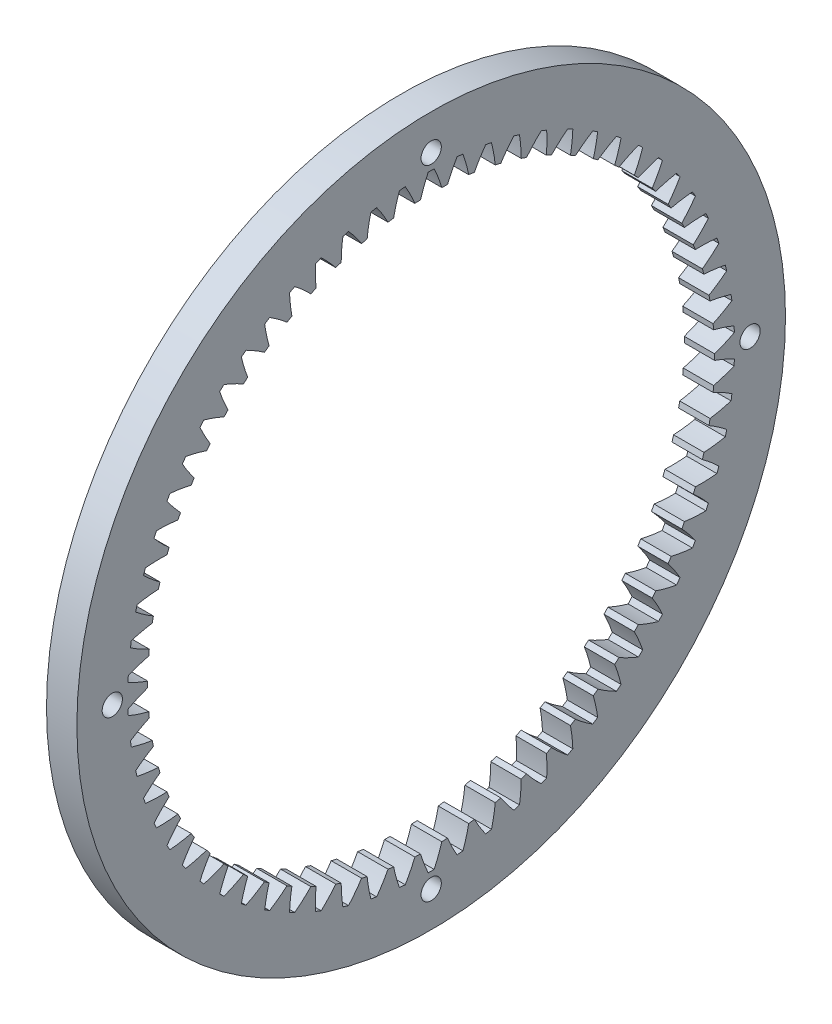
from build123d import *

# Parameters (mm, degrees)
METRIC_INTERNAL_SPUR_GEAR_1_75M_66_2_R       = 70
METRIC_INTERNAL_SPUR_GEAR_1_75M_66T_20_DEPTH = 6
CUT_EXTRUDE1_DEPTH                           = 100.176610146
CUT_EXTRUDE1_DEPTH_BACK                      = 100.176610146
SKETCH1_R                                    = 2


# Read off the part's stored shape, not the designer's step: Metric - Internal spur gear 1.75M 66T 20PA 6FW ---S66S140OD 1AF
with BuildPart() as part:
    # Metric - Internal spur gear 1.75M 66 2 → Metric - Internal spur gear 1.75M 66T 20 (new body)
    with BuildSketch(Plane.YZ):
        Circle(METRIC_INTERNAL_SPUR_GEAR_1_75M_66_2_R)
        with BuildLine():
            ThreePointArc((59.935672078, -0.582232555), (57.976135812, -1.414265202), (55.960623747, -2.099664224))
            ThreePointArc((55.960623747, -2.099664224), (55.936570994, -2.664587286), (55.906815483, -3.229238693))
            ThreePointArc((55.906815483, -3.229238693), (57.848049834, -4.103120777), (59.719623438, -5.117651679))
            ThreePointArc((59.719623438, -5.117651679), (59.667093831, -5.697516651), (59.608933992, -6.276844002))
            ThreePointArc((59.608933992, -6.276844002), (57.579180926, -6.918843376), (55.507643936, -7.409552256))
            ThreePointArc((55.507643936, -7.409552256), (55.430000745, -7.969630943), (55.346706441, -8.528897123))
            ThreePointArc((55.346706441, -8.528897123), (57.196082959, -9.583348259), (58.962744639, -10.771189668))
            ThreePointArc((58.962744639, -10.771189668), (58.855333221, -11.34343571), (58.742368168, -11.914611377))
            ThreePointArc((58.742368168, -11.914611377), (56.660780061, -12.360763433), (54.551978307, -12.652338235))
            ThreePointArc((54.551978307, -12.652338235), (54.421447826, -13.202500388), (54.285369055, -13.751316541))
            ThreePointArc((54.285369055, -13.751316541), (56.026139501, -14.976787454), (57.671890095, -16.327182095))
            ThreePointArc((57.671890095, -16.327182095), (57.510569599, -16.886626858), (57.343822362, -17.444478186))
            ThreePointArc((57.343822362, -17.444478186), (55.229250398, -17.690742502), (53.102281514, -17.78054268))
            ThreePointArc((53.102281514, -17.78054268), (52.920045848, -18.315805946), (52.73241496, -18.849201907))
            ThreePointArc((52.73241496, -18.849201907), (54.348814646, -20.234594544), (55.858749983, -21.735313032))
            ThreePointArc((55.858749983, -21.735313032), (55.644981353, -22.276890098), (55.42596202, -22.8163651))
            ThreePointArc((55.42596202, -22.8163651), (53.29755609, -22.860511468), (51.171682237, -22.747723778))
            ThreePointArc((51.171682237, -22.747723778), (50.93939174, -23.263240728), (50.701907949, -23.776385981))
            ThreePointArc((50.701907949, -23.776385981), (52.17929851, -25.309154011), (53.539744381, -26.946605609))
            ThreePointArc((53.539744381, -26.946605609), (53.275463539, -27.465410372), (53.006155584, -27.981623478))
            ThreePointArc((53.006155584, -27.981623478), (50.883190862, -27.823252101), (48.777664281, -27.508897966))
            ThreePointArc((48.777664281, -27.508897966), (48.497422612, -28), (48.212236609, -28.488247422))
            ThreePointArc((48.212236609, -28.488247422), (49.537238567, -30.154509861), (50.735874563, -31.913865553))
            ThreePointArc((50.735874563, -31.913865553), (50.423474878, -32.405199637), (50.106317194, -32.893475941))
            ThreePointArc((50.106317194, -32.893475941), (48.008019577, -32.534021056), (45.941908244, -32.020947314))
            ThreePointArc((45.941908244, -32.020947314), (45.616253315, -32.483186936), (45.285947788, -32.942114883))
            ThreePointArc((45.285947788, -32.942114883), (46.44656172, -34.7267818), (47.472532809, -36.592108589))
            ThreePointArc((47.472532809, -36.592108589), (47.114843419, -37.051522396), (46.752708237, -37.507439992))
            ThreePointArc((46.752708237, -37.507439992), (44.698080233, -36.950156877), (42.690095172, -36.243010005))
            ThreePointArc((42.690095172, -36.243010005), (42.321976164, -36.672201101), (41.949542411, -37.09765345))
            ThreePointArc((41.949542411, -37.09765345), (42.935257617, -38.984562625), (43.779272446, -40.938967822))
            ThreePointArc((43.779272446, -40.938967822), (43.379532643, -41.36230083), (42.975699514, -41.781730859))
            ThreePointArc((42.975699514, -41.781730859), (40.983348153, -41.031666356), (39.051673987, -40.136850385))
            ThreePointArc((39.051673987, -40.136850385), (38.644424643, -40.529106134), (38.233235482, -40.917229923))
            ThreePointArc((38.233235482, -40.917229923), (39.035125173, -42.889293215), (39.689540213, -44.915077423))
            ThreePointArc((39.689540213, -44.915077423), (39.251370102, -45.298495862), (38.809496201, -45.6776399))
            ThreePointArc((38.809496201, -45.6776399), (36.897464525, -44.741586711), (35.059594795, -43.667205232))
            ThreePointArc((35.059594795, -43.667205232), (34.616903228, -44.018973306), (34.170682452, -44.366253625))
            ThreePointArc((34.170682452, -44.366253625), (34.781484591, -46.405611723), (35.240373357, -48.484429128))
            ThreePointArc((35.240373357, -48.484429128), (34.767741074, -48.824460702), (34.291828081, -49.159885162))
            ThreePointArc((34.291828081, -49.159885162), (32.477431745, -48.046320327), (30.750010484, -46.802103107))
            ThreePointArc((30.750010484, -46.802103107), (30.275885777, -47.110197839), (29.798674431, -47.413489665))
            ThreePointArc((29.798674431, -47.413489665), (30.212857498, -49.501673826), (30.472064223, -51.614698335))
            ThreePointArc((30.472064223, -51.614698335), (29.96925, -51.908263665), (29.463607855, -52.19693089))
            ThreePointArc((29.463607855, -52.19693089), (27.763278314, -50.915939027), (26.161949316, -49.513153888))
            ThreePointArc((26.161949316, -49.513153888), (25.660685217, -49.774785125), (25.156804999, -50.031341799))
            ThreePointArc((25.156804999, -50.031341799), (25.37061809, -52.149441104), (25.427795357, -54.277536841))
            ThreePointArc((25.427795357, -54.277536841), (24.899352757, -54.521977354), (24.368560635, -54.76127313))
            ThreePointArc((24.368560635, -54.76127313), (22.797696335, -53.324455099), (21.336961484, -51.775805881))
            ThreePointArc((21.336961484, -51.775805881), (20.813097517, -51.988604249), (20.287111645, -52.196102355))
            ThreePointArc((20.287111645, -52.196102355), (20.298618435, -54.324934969), (20.153248438, -56.448829568))
            ThreePointArc((20.153248438, -56.448829568), (19.603963119, -56.641931572), (19.052827955, -56.8296888))
            ThreePointArc((19.052827955, -56.8296888), (17.625654888, -55.250056647), (16.318742824, -53.569568158))
            ThreePointArc((16.318742824, -53.569568158), (15.777023183, -53.731606522), (15.233695067, -53.888166926))
            ThreePointArc((15.233695067, -53.888166926), (15.042791348, -56.008453811), (14.696190581, -58.108912954))
            ThreePointArc((14.696190581, -58.108912954), (14.131036956, -58.248927688), (13.564549916, -58.383446009))
            ThreePointArc((13.564549916, -58.383446009), (12.29399278, -56.675305128), (11.152739103, -54.87819613))
            ThreePointArc((11.152739103, -54.87819613), (10.598069685, -54.988007047), (10.042319788, -55.092211911))
            ThreePointArc((10.042319788, -55.092211911), (9.650734413, -57.184751421), (9.106041746, -59.242753025))
            ThreePointArc((9.106041746, -59.242753025), (8.530137934, -59.328412494), (7.953429211, -59.408473689))
            ThreePointArc((7.953429211, -59.408473689), (6.850994371, -57.587293268), (5.885734449, -55.68983866))
            ThreePointArc((5.885734449, -55.68983866), (5.323138425, -55.746427664), (4.759999705, -55.797333295))
            ThreePointArc((4.759999705, -55.797333295), (4.171278933, -57.843175067), (3.433427187, -59.840081551))
            ThreePointArc((3.433427187, -59.840081551), (2.851988661, -59.87061001), (2.27028102, -59.895489032))
            ThreePointArc((2.27028102, -59.895489032), (1.345952295, -57.977761962), (0.565427672, -55.997145387))
            ThreePointArc((0.565427672, -55.997145387), (0, -56), (-0.565427672, -55.997145387))
            ThreePointArc((-0.565427672, -55.997145387), (-1.345952295, -57.977761962), (-2.27028102, -59.895489032))
            ThreePointArc((-2.27028102, -59.895489032), (-2.851988661, -59.87061001), (-3.433427187, -59.840081551))
            ThreePointArc((-3.433427187, -59.840081551), (-4.171278933, -57.843175067), (-4.759999705, -55.797333295))
            ThreePointArc((-4.759999705, -55.797333295), (-5.323138425, -55.746427664), (-5.885734449, -55.68983866))
            ThreePointArc((-5.885734449, -55.68983866), (-6.850994371, -57.587293268), (-7.953429211, -59.408473689))
            ThreePointArc((-7.953429211, -59.408473689), (-8.530137934, -59.328412494), (-9.106041746, -59.242753025))
            ThreePointArc((-9.106041746, -59.242753025), (-9.650734413, -57.184751421), (-10.042319788, -55.092211911))
            ThreePointArc((-10.042319788, -55.092211911), (-10.598069685, -54.988007047), (-11.152739103, -54.87819613))
            ThreePointArc((-11.152739103, -54.87819613), (-12.29399278, -56.675305128), (-13.564549916, -58.383446009))
            ThreePointArc((-13.564549916, -58.383446009), (-14.131036956, -58.248927688), (-14.696190581, -58.108912954))
            ThreePointArc((-14.696190581, -58.108912954), (-15.042791348, -56.008453811), (-15.233695067, -53.888166926))
            ThreePointArc((-15.233695067, -53.888166926), (-15.777023183, -53.731606522), (-16.318742824, -53.569568158))
            ThreePointArc((-16.318742824, -53.569568158), (-17.625654888, -55.250056647), (-19.052827955, -56.8296888))
            ThreePointArc((-19.052827955, -56.8296888), (-19.603963119, -56.641931572), (-20.153248438, -56.448829568))
            ThreePointArc((-20.153248438, -56.448829568), (-20.298618435, -54.324934969), (-20.287111645, -52.196102355))
            ThreePointArc((-20.287111645, -52.196102355), (-20.813097517, -51.988604249), (-21.336961484, -51.775805881))
            ThreePointArc((-21.336961484, -51.775805881), (-22.797696335, -53.324455099), (-24.368560635, -54.76127313))
            ThreePointArc((-24.368560635, -54.76127313), (-24.899352757, -54.521977354), (-25.427795357, -54.277536841))
            ThreePointArc((-25.427795357, -54.277536841), (-25.37061809, -52.149441104), (-25.156804999, -50.031341799))
            ThreePointArc((-25.156804999, -50.031341799), (-25.660685217, -49.774785125), (-26.161949316, -49.513153888))
            ThreePointArc((-26.161949316, -49.513153888), (-27.763278314, -50.915939027), (-29.463607855, -52.19693089))
            ThreePointArc((-29.463607855, -52.19693089), (-29.96925, -51.908263665), (-30.472064223, -51.614698335))
            ThreePointArc((-30.472064223, -51.614698335), (-30.212857498, -49.501673826), (-29.798674431, -47.413489665))
            ThreePointArc((-29.798674431, -47.413489665), (-30.275885777, -47.110197839), (-30.750010484, -46.802103107))
            ThreePointArc((-30.750010484, -46.802103107), (-32.477431745, -48.046320327), (-34.291828081, -49.159885162))
            ThreePointArc((-34.291828081, -49.159885162), (-34.767741074, -48.824460702), (-35.240373357, -48.484429128))
            ThreePointArc((-35.240373357, -48.484429128), (-34.781484591, -46.405611723), (-34.170682452, -44.366253625))
            ThreePointArc((-34.170682452, -44.366253625), (-34.616903228, -44.018973306), (-35.059594795, -43.667205232))
            ThreePointArc((-35.059594795, -43.667205232), (-36.897464525, -44.741586711), (-38.809496201, -45.6776399))
            ThreePointArc((-38.809496201, -45.6776399), (-39.251370102, -45.298495862), (-39.689540213, -44.915077423))
            ThreePointArc((-39.689540213, -44.915077423), (-39.035125173, -42.889293215), (-38.233235482, -40.917229923))
            ThreePointArc((-38.233235482, -40.917229923), (-38.644424643, -40.529106134), (-39.051673987, -40.136850385))
            ThreePointArc((-39.051673987, -40.136850385), (-40.983348153, -41.031666356), (-42.975699514, -41.781730859))
            ThreePointArc((-42.975699514, -41.781730859), (-43.379532643, -41.36230083), (-43.779272446, -40.938967822))
            ThreePointArc((-43.779272446, -40.938967822), (-42.935257617, -38.984562625), (-41.949542411, -37.09765345))
            ThreePointArc((-41.949542411, -37.09765345), (-42.321976164, -36.672201101), (-42.690095172, -36.243010005))
            ThreePointArc((-42.690095172, -36.243010005), (-44.698080233, -36.950156877), (-46.752708237, -37.507439992))
            ThreePointArc((-46.752708237, -37.507439992), (-47.114843419, -37.051522396), (-47.472532809, -36.592108589))
            ThreePointArc((-47.472532809, -36.592108589), (-46.44656172, -34.7267818), (-45.285947788, -32.942114883))
            ThreePointArc((-45.285947788, -32.942114883), (-45.616253315, -32.483186936), (-45.941908244, -32.020947314))
            ThreePointArc((-45.941908244, -32.020947314), (-48.008019577, -32.534021056), (-50.106317194, -32.893475941))
            ThreePointArc((-50.106317194, -32.893475941), (-50.423474878, -32.405199637), (-50.735874563, -31.913865553))
            ThreePointArc((-50.735874563, -31.913865553), (-49.537238567, -30.154509861), (-48.212236609, -28.488247422))
            ThreePointArc((-48.212236609, -28.488247422), (-48.497422612, -28), (-48.777664281, -27.508897966))
            ThreePointArc((-48.777664281, -27.508897966), (-50.883190862, -27.823252101), (-53.006155584, -27.981623478))
            ThreePointArc((-53.006155584, -27.981623478), (-53.275463539, -27.465410372), (-53.539744381, -26.946605609))
            ThreePointArc((-53.539744381, -26.946605609), (-52.17929851, -25.309154011), (-50.701907949, -23.776385981))
            ThreePointArc((-50.701907949, -23.776385981), (-50.93939174, -23.263240728), (-51.171682237, -22.747723778))
            ThreePointArc((-51.171682237, -22.747723778), (-53.29755609, -22.860511468), (-55.42596202, -22.8163651))
            ThreePointArc((-55.42596202, -22.8163651), (-55.644981353, -22.276890098), (-55.858749983, -21.735313032))
            ThreePointArc((-55.858749983, -21.735313032), (-54.348814646, -20.234594544), (-52.73241496, -18.849201907))
            ThreePointArc((-52.73241496, -18.849201907), (-52.920045848, -18.315805946), (-53.102281514, -17.78054268))
            ThreePointArc((-53.102281514, -17.78054268), (-55.229250398, -17.690742502), (-57.343822362, -17.444478186))
            ThreePointArc((-57.343822362, -17.444478186), (-57.510569599, -16.886626858), (-57.671890095, -16.327182095))
            ThreePointArc((-57.671890095, -16.327182095), (-56.026139501, -14.976787454), (-54.285369055, -13.751316541))
            ThreePointArc((-54.285369055, -13.751316541), (-54.421447826, -13.202500388), (-54.551978307, -12.652338235))
            ThreePointArc((-54.551978307, -12.652338235), (-56.660780061, -12.360763433), (-58.742368168, -11.914611377))
            ThreePointArc((-58.742368168, -11.914611377), (-58.855333221, -11.34343571), (-58.962744639, -10.771189668))
            ThreePointArc((-58.962744639, -10.771189668), (-57.196082959, -9.583348259), (-55.346706441, -8.528897123))
            ThreePointArc((-55.346706441, -8.528897123), (-55.430000745, -7.969630943), (-55.507643936, -7.409552256))
            ThreePointArc((-55.507643936, -7.409552256), (-57.579180926, -6.918843376), (-59.608933992, -6.276844002))
            ThreePointArc((-59.608933992, -6.276844002), (-59.667093831, -5.697516651), (-59.719623438, -5.117651679))
            ThreePointArc((-59.719623438, -5.117651679), (-57.848049834, -4.103120777), (-55.906815483, -3.229238693))
            ThreePointArc((-55.906815483, -3.229238693), (-55.936570994, -2.664587286), (-55.960623747, -2.099664224))
            ThreePointArc((-55.960623747, -2.099664224), (-57.976135812, -1.414265202), (-59.935672078, -0.582232555))
            ThreePointArc((-59.935672078, -0.582232555), (-59.9385, 0), (-59.935672078, 0.582232555))
            ThreePointArc((-59.935672078, 0.582232555), (-57.976135812, 1.414265202), (-55.960623747, 2.099664224))
            ThreePointArc((-55.960623747, 2.099664224), (-55.936570994, 2.664587286), (-55.906815483, 3.229238693))
            ThreePointArc((-55.906815483, 3.229238693), (-57.848049834, 4.103120777), (-59.719623438, 5.117651679))
            ThreePointArc((-59.719623438, 5.117651679), (-59.667093831, 5.697516651), (-59.608933992, 6.276844002))
            ThreePointArc((-59.608933992, 6.276844002), (-57.579180926, 6.918843376), (-55.507643936, 7.409552256))
            ThreePointArc((-55.507643936, 7.409552256), (-55.430000745, 7.969630943), (-55.346706441, 8.528897123))
            ThreePointArc((-55.346706441, 8.528897123), (-57.196082959, 9.583348259), (-58.962744639, 10.771189668))
            ThreePointArc((-58.962744639, 10.771189668), (-58.855333221, 11.34343571), (-58.742368168, 11.914611377))
            ThreePointArc((-58.742368168, 11.914611377), (-56.660780061, 12.360763433), (-54.551978307, 12.652338235))
            ThreePointArc((-54.551978307, 12.652338235), (-54.421447826, 13.202500388), (-54.285369055, 13.751316541))
            ThreePointArc((-54.285369055, 13.751316541), (-56.026139501, 14.976787454), (-57.671890095, 16.327182095))
            ThreePointArc((-57.671890095, 16.327182095), (-57.510569599, 16.886626858), (-57.343822362, 17.444478186))
            ThreePointArc((-57.343822362, 17.444478186), (-55.229250398, 17.690742502), (-53.102281514, 17.78054268))
            ThreePointArc((-53.102281514, 17.78054268), (-52.920045848, 18.315805946), (-52.73241496, 18.849201907))
            ThreePointArc((-52.73241496, 18.849201907), (-54.348814646, 20.234594544), (-55.858749983, 21.735313032))
            ThreePointArc((-55.858749983, 21.735313032), (-55.644981353, 22.276890098), (-55.42596202, 22.8163651))
            ThreePointArc((-55.42596202, 22.8163651), (-53.29755609, 22.860511468), (-51.171682237, 22.747723778))
            ThreePointArc((-51.171682237, 22.747723778), (-50.93939174, 23.263240728), (-50.701907949, 23.776385981))
            ThreePointArc((-50.701907949, 23.776385981), (-52.17929851, 25.309154011), (-53.539744381, 26.946605609))
            ThreePointArc((-53.539744381, 26.946605609), (-53.275463539, 27.465410372), (-53.006155584, 27.981623478))
            ThreePointArc((-53.006155584, 27.981623478), (-50.883190862, 27.823252101), (-48.777664281, 27.508897966))
            ThreePointArc((-48.777664281, 27.508897966), (-48.497422612, 28), (-48.212236609, 28.488247422))
            ThreePointArc((-48.212236609, 28.488247422), (-49.537238567, 30.154509861), (-50.735874563, 31.913865553))
            ThreePointArc((-50.735874563, 31.913865553), (-50.423474878, 32.405199637), (-50.106317194, 32.893475941))
            ThreePointArc((-50.106317194, 32.893475941), (-48.008019577, 32.534021056), (-45.941908244, 32.020947314))
            ThreePointArc((-45.941908244, 32.020947314), (-45.616253315, 32.483186936), (-45.285947788, 32.942114883))
            ThreePointArc((-45.285947788, 32.942114883), (-46.44656172, 34.7267818), (-47.472532809, 36.592108589))
            ThreePointArc((-47.472532809, 36.592108589), (-47.114843419, 37.051522396), (-46.752708237, 37.507439992))
            ThreePointArc((-46.752708237, 37.507439992), (-44.698080233, 36.950156877), (-42.690095172, 36.243010005))
            ThreePointArc((-42.690095172, 36.243010005), (-42.321976164, 36.672201101), (-41.949542411, 37.09765345))
            ThreePointArc((-41.949542411, 37.09765345), (-42.935257617, 38.984562625), (-43.779272446, 40.938967822))
            ThreePointArc((-43.779272446, 40.938967822), (-43.379532643, 41.36230083), (-42.975699514, 41.781730859))
            ThreePointArc((-42.975699514, 41.781730859), (-40.983348153, 41.031666356), (-39.051673987, 40.136850385))
            ThreePointArc((-39.051673987, 40.136850385), (-38.644424643, 40.529106134), (-38.233235482, 40.917229923))
            ThreePointArc((-38.233235482, 40.917229923), (-39.035125173, 42.889293215), (-39.689540213, 44.915077423))
            ThreePointArc((-39.689540213, 44.915077423), (-39.251370102, 45.298495862), (-38.809496201, 45.6776399))
            ThreePointArc((-38.809496201, 45.6776399), (-36.897464525, 44.741586711), (-35.059594795, 43.667205232))
            ThreePointArc((-35.059594795, 43.667205232), (-34.616903228, 44.018973306), (-34.170682452, 44.366253625))
            ThreePointArc((-34.170682452, 44.366253625), (-34.781484591, 46.405611723), (-35.240373357, 48.484429128))
            ThreePointArc((-35.240373357, 48.484429128), (-34.767741074, 48.824460702), (-34.291828081, 49.159885162))
            ThreePointArc((-34.291828081, 49.159885162), (-32.477431745, 48.046320327), (-30.750010484, 46.802103107))
            ThreePointArc((-30.750010484, 46.802103107), (-30.275885777, 47.110197839), (-29.798674431, 47.413489665))
            ThreePointArc((-29.798674431, 47.413489665), (-30.212857498, 49.501673826), (-30.472064223, 51.614698335))
            ThreePointArc((-30.472064223, 51.614698335), (-29.96925, 51.908263665), (-29.463607855, 52.19693089))
            ThreePointArc((-29.463607855, 52.19693089), (-27.763278314, 50.915939027), (-26.161949316, 49.513153888))
            ThreePointArc((-26.161949316, 49.513153888), (-25.660685217, 49.774785125), (-25.156804999, 50.031341799))
            ThreePointArc((-25.156804999, 50.031341799), (-25.37061809, 52.149441104), (-25.427795357, 54.277536841))
            ThreePointArc((-25.427795357, 54.277536841), (-24.899352757, 54.521977354), (-24.368560635, 54.76127313))
            ThreePointArc((-24.368560635, 54.76127313), (-22.797696335, 53.324455099), (-21.336961484, 51.775805881))
            ThreePointArc((-21.336961484, 51.775805881), (-20.813097517, 51.988604249), (-20.287111645, 52.196102355))
            ThreePointArc((-20.287111645, 52.196102355), (-20.298618435, 54.324934969), (-20.153248438, 56.448829568))
            ThreePointArc((-20.153248438, 56.448829568), (-19.603963119, 56.641931572), (-19.052827955, 56.8296888))
            ThreePointArc((-19.052827955, 56.8296888), (-17.625654888, 55.250056647), (-16.318742824, 53.569568158))
            ThreePointArc((-16.318742824, 53.569568158), (-15.777023183, 53.731606522), (-15.233695067, 53.888166926))
            ThreePointArc((-15.233695067, 53.888166926), (-15.042791348, 56.008453811), (-14.696190581, 58.108912954))
            ThreePointArc((-14.696190581, 58.108912954), (-14.131036956, 58.248927688), (-13.564549916, 58.383446009))
            ThreePointArc((-13.564549916, 58.383446009), (-12.29399278, 56.675305128), (-11.152739103, 54.87819613))
            ThreePointArc((-11.152739103, 54.87819613), (-10.598069685, 54.988007047), (-10.042319788, 55.092211911))
            ThreePointArc((-10.042319788, 55.092211911), (-9.650734413, 57.184751421), (-9.106041746, 59.242753025))
            ThreePointArc((-9.106041746, 59.242753025), (-8.530137934, 59.328412494), (-7.953429211, 59.408473689))
            ThreePointArc((-7.953429211, 59.408473689), (-6.850994371, 57.587293268), (-5.885734449, 55.68983866))
            ThreePointArc((-5.885734449, 55.68983866), (-5.323138425, 55.746427664), (-4.759999705, 55.797333295))
            ThreePointArc((-4.759999705, 55.797333295), (-4.171278933, 57.843175067), (-3.433427187, 59.840081551))
            ThreePointArc((-3.433427187, 59.840081551), (-2.851988661, 59.87061001), (-2.27028102, 59.895489032))
            ThreePointArc((-2.27028102, 59.895489032), (-1.345952295, 57.977761962), (-0.565427672, 55.997145387))
            ThreePointArc((-0.565427672, 55.997145387), (0, 56), (0.565427672, 55.997145387))
            ThreePointArc((0.565427672, 55.997145387), (1.345952295, 57.977761962), (2.27028102, 59.895489032))
            ThreePointArc((2.27028102, 59.895489032), (2.851988661, 59.87061001), (3.433427187, 59.840081551))
            ThreePointArc((3.433427187, 59.840081551), (4.171278933, 57.843175067), (4.759999705, 55.797333295))
            ThreePointArc((4.759999705, 55.797333295), (5.323138425, 55.746427664), (5.885734449, 55.68983866))
            ThreePointArc((5.885734449, 55.68983866), (6.850994371, 57.587293268), (7.953429211, 59.408473689))
            ThreePointArc((7.953429211, 59.408473689), (8.530137934, 59.328412494), (9.106041746, 59.242753025))
            ThreePointArc((9.106041746, 59.242753025), (9.650734413, 57.184751421), (10.042319788, 55.092211911))
            ThreePointArc((10.042319788, 55.092211911), (10.598069685, 54.988007047), (11.152739103, 54.87819613))
            ThreePointArc((11.152739103, 54.87819613), (12.29399278, 56.675305128), (13.564549916, 58.383446009))
            ThreePointArc((13.564549916, 58.383446009), (14.131036956, 58.248927688), (14.696190581, 58.108912954))
            ThreePointArc((14.696190581, 58.108912954), (15.042791348, 56.008453811), (15.233695067, 53.888166926))
            ThreePointArc((15.233695067, 53.888166926), (15.777023183, 53.731606522), (16.318742824, 53.569568158))
            ThreePointArc((16.318742824, 53.569568158), (17.625654888, 55.250056647), (19.052827955, 56.8296888))
            ThreePointArc((19.052827955, 56.8296888), (19.603963119, 56.641931572), (20.153248438, 56.448829568))
            ThreePointArc((20.153248438, 56.448829568), (20.298618435, 54.324934969), (20.287111645, 52.196102355))
            ThreePointArc((20.287111645, 52.196102355), (20.813097517, 51.988604249), (21.336961484, 51.775805881))
            ThreePointArc((21.336961484, 51.775805881), (22.797696335, 53.324455099), (24.368560635, 54.76127313))
            ThreePointArc((24.368560635, 54.76127313), (24.899352757, 54.521977354), (25.427795357, 54.277536841))
            ThreePointArc((25.427795357, 54.277536841), (25.37061809, 52.149441104), (25.156804999, 50.031341799))
            ThreePointArc((25.156804999, 50.031341799), (25.660685217, 49.774785125), (26.161949316, 49.513153888))
            ThreePointArc((26.161949316, 49.513153888), (27.763278314, 50.915939027), (29.463607855, 52.19693089))
            ThreePointArc((29.463607855, 52.19693089), (29.96925, 51.908263665), (30.472064223, 51.614698335))
            ThreePointArc((30.472064223, 51.614698335), (30.212857498, 49.501673826), (29.798674431, 47.413489665))
            ThreePointArc((29.798674431, 47.413489665), (30.275885777, 47.110197839), (30.750010484, 46.802103107))
            ThreePointArc((30.750010484, 46.802103107), (32.477431745, 48.046320327), (34.291828081, 49.159885162))
            ThreePointArc((34.291828081, 49.159885162), (34.767741074, 48.824460702), (35.240373357, 48.484429128))
            ThreePointArc((35.240373357, 48.484429128), (34.781484591, 46.405611723), (34.170682452, 44.366253625))
            ThreePointArc((34.170682452, 44.366253625), (34.616903228, 44.018973306), (35.059594795, 43.667205232))
            ThreePointArc((35.059594795, 43.667205232), (36.897464525, 44.741586711), (38.809496201, 45.6776399))
            ThreePointArc((38.809496201, 45.6776399), (39.251370102, 45.298495862), (39.689540213, 44.915077423))
            ThreePointArc((39.689540213, 44.915077423), (39.035125173, 42.889293215), (38.233235482, 40.917229923))
            ThreePointArc((38.233235482, 40.917229923), (38.644424643, 40.529106134), (39.051673987, 40.136850385))
            ThreePointArc((39.051673987, 40.136850385), (40.983348153, 41.031666356), (42.975699514, 41.781730859))
            ThreePointArc((42.975699514, 41.781730859), (43.379532643, 41.36230083), (43.779272446, 40.938967822))
            ThreePointArc((43.779272446, 40.938967822), (42.935257617, 38.984562625), (41.949542411, 37.09765345))
            ThreePointArc((41.949542411, 37.09765345), (42.321976164, 36.672201101), (42.690095172, 36.243010005))
            ThreePointArc((42.690095172, 36.243010005), (44.698080233, 36.950156877), (46.752708237, 37.507439992))
            ThreePointArc((46.752708237, 37.507439992), (47.114843419, 37.051522396), (47.472532809, 36.592108589))
            ThreePointArc((47.472532809, 36.592108589), (46.44656172, 34.7267818), (45.285947788, 32.942114883))
            ThreePointArc((45.285947788, 32.942114883), (45.616253315, 32.483186936), (45.941908244, 32.020947314))
            ThreePointArc((45.941908244, 32.020947314), (48.008019577, 32.534021056), (50.106317194, 32.893475941))
            ThreePointArc((50.106317194, 32.893475941), (50.423474878, 32.405199637), (50.735874563, 31.913865553))
            ThreePointArc((50.735874563, 31.913865553), (49.537238567, 30.154509861), (48.212236609, 28.488247422))
            ThreePointArc((48.212236609, 28.488247422), (48.497422612, 28), (48.777664281, 27.508897966))
            ThreePointArc((48.777664281, 27.508897966), (50.883190862, 27.823252101), (53.006155584, 27.981623478))
            ThreePointArc((53.006155584, 27.981623478), (53.275463539, 27.465410372), (53.539744381, 26.946605609))
            ThreePointArc((53.539744381, 26.946605609), (52.17929851, 25.309154011), (50.701907949, 23.776385981))
            ThreePointArc((50.701907949, 23.776385981), (50.93939174, 23.263240728), (51.171682237, 22.747723778))
            ThreePointArc((51.171682237, 22.747723778), (53.29755609, 22.860511468), (55.42596202, 22.8163651))
            ThreePointArc((55.42596202, 22.8163651), (55.644981353, 22.276890098), (55.858749983, 21.735313032))
            ThreePointArc((55.858749983, 21.735313032), (54.348814646, 20.234594544), (52.73241496, 18.849201907))
            ThreePointArc((52.73241496, 18.849201907), (52.920045848, 18.315805946), (53.102281514, 17.78054268))
            ThreePointArc((53.102281514, 17.78054268), (55.229250398, 17.690742502), (57.343822362, 17.444478186))
            ThreePointArc((57.343822362, 17.444478186), (57.510569599, 16.886626858), (57.671890095, 16.327182095))
            ThreePointArc((57.671890095, 16.327182095), (56.026139501, 14.976787454), (54.285369055, 13.751316541))
            ThreePointArc((54.285369055, 13.751316541), (54.421447826, 13.202500388), (54.551978307, 12.652338235))
            ThreePointArc((54.551978307, 12.652338235), (56.660780061, 12.360763433), (58.742368168, 11.914611377))
            ThreePointArc((58.742368168, 11.914611377), (58.855333221, 11.34343571), (58.962744639, 10.771189668))
            ThreePointArc((58.962744639, 10.771189668), (57.196082959, 9.583348259), (55.346706441, 8.528897123))
            ThreePointArc((55.346706441, 8.528897123), (55.430000745, 7.969630943), (55.507643936, 7.409552256))
            ThreePointArc((55.507643936, 7.409552256), (57.579180926, 6.918843376), (59.608933992, 6.276844002))
            ThreePointArc((59.608933992, 6.276844002), (59.667093831, 5.697516651), (59.719623438, 5.117651679))
            ThreePointArc((59.719623438, 5.117651679), (57.848049834, 4.103120777), (55.906815483, 3.229238693))
            ThreePointArc((55.906815483, 3.229238693), (55.936570994, 2.664587286), (55.960623747, 2.099664224))
            ThreePointArc((55.960623747, 2.099664224), (57.976135812, 1.414265202), (59.935672078, 0.582232555))
            ThreePointArc((59.935672078, 0.582232555), (59.9385, 0), (59.935672078, -0.582232555))
        make_face(mode=Mode.SUBTRACT)
    extrude(amount=METRIC_INTERNAL_SPUR_GEAR_1_75M_66T_20_DEPTH)

    # Sketch1 → Cut-Extrude1 (cut, two sides: drawn at the far end of the back side and taken through both)
    with BuildSketch(Plane(origin=(0, 0, 0), x_dir=(0, 0, -1), z_dir=(1, 0, 0)).offset(-CUT_EXTRUDE1_DEPTH_BACK)):
        with Locations((0, 63)):
            Circle(SKETCH1_R)
        with Locations((63, 0)):
            Circle(SKETCH1_R)
        with Locations((0, -63)):
            Circle(SKETCH1_R)
        with Locations((-63, 0)):
            Circle(SKETCH1_R)
    extrude(amount=CUT_EXTRUDE1_DEPTH + CUT_EXTRUDE1_DEPTH_BACK, mode=Mode.SUBTRACT)


solid = part.part
